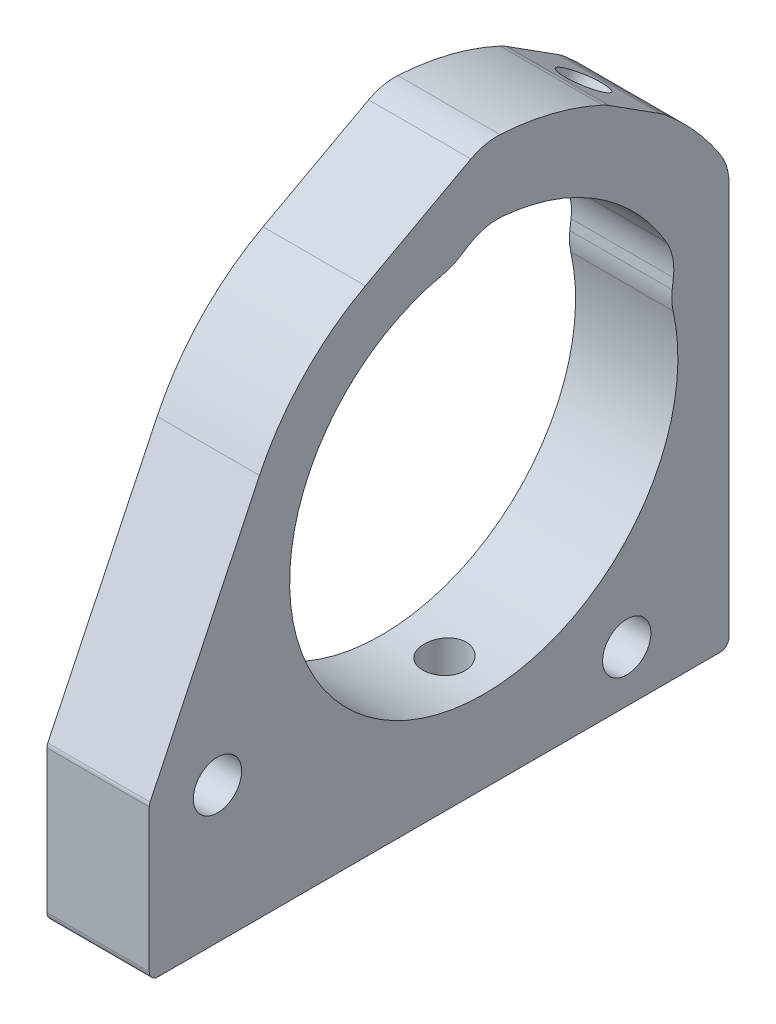
from build123d import *

# Parameters (mm, degrees)
SKETCH1_R               = 2.2479
BOSS_EXTRUDE1_DEPTH     = 4.7625
SKETCH2_R               = 2.0193
CUT_EXTRUDE1_DEPTH      = 9.525
FILLET1_R               = 0.8255
FILLET2_R               = 5.08
FILLET3_R               = 5.08
CUT_EXTRUDE2_REACH      = 67.899
CUT_EXTRUDE2_END_RADIUS = 19.6596
SKETCH4_R               = 2.0193


with BuildPart() as part:
    # Sketch1 → Boss-Extrude1 (new, symmetric)
    with BuildSketch(Plane(origin=(0, 0, 0), x_dir=(0, 0, -1), z_dir=(1, 0, 0))):
        with BuildLine():
            Line((-31.1404, -25.6921), (22.8346, -25.6921))
            Line((22.8346, -25.6921), (22.8346, 3.821096341))
            Line((22.8346, 3.821096341), (22.8346, 13.103329243))
            ThreePointArc((22.8346, 13.103329243), (20.105248524, 16.996916667), (16.720065807, 20.336066331))
            Line((16.720065807, 20.336066331), (11.364530126, 23.747918844))
            ThreePointArc((11.364530126, 23.747918844), (5.82676412, 25.674209127), (0, 26.3271))
            Line((0, 26.3271), (-11.022257836, 20.35999918))
            ThreePointArc((-11.022257836, 20.35999918), (-16.769041287, 15.963050734), (-20.8778164, 10.006823511))
            Line((-20.8778164, 10.006823511), (-31.1404, -11.4046))
            Line((-31.1404, -11.4046), (-31.1404, -25.6921))
        make_face()
        with Locations(Location((13.3096, -20.9169, 0), (0, 0, 180))):
            Circle(SKETCH1_R, mode=Mode.SUBTRACT)
        with Locations(Location((-24.7904, -12.9921, 0), (0, 0, 180))):
            Circle(SKETCH1_R, mode=Mode.SUBTRACT)
        with BuildLine():
            Line((0, 19.6596), (0, 18.0721))
            ThreePointArc((0, 18.0721), (-9.710132252, -15.241854548), (16.378884958, 7.637599488))
            Line((16.378884958, 7.637599488), (17.81764857, 8.308505979))
            ThreePointArc((17.81764857, 8.308505979), (10.56309538, 16.580738468), (0, 19.6596))
        make_face(mode=Mode.SUBTRACT)
    extrude(amount=BOSS_EXTRUDE1_DEPTH, both=True)

    # Sketch2 → Cut-Extrude1 (cut)
    with BuildSketch(Plane.XZ.offset(25.6921)):
        with Locations(Location((0, -1.09474, 0), (0, 0, 270))):
            Circle(SKETCH2_R)
        with Locations(Location((0, 24.30526, 0), (0, 0, 270))):
            Circle(SKETCH2_R)
    extrude(amount=-CUT_EXTRUDE1_DEPTH, mode=Mode.SUBTRACT)

    # Fillet1
    fillet1_edges = [part.edges().sort_by_distance(p)[0] for p in [
        (0, -25.6921, -22.8346),
        (0, -25.6921, 31.1404),
        (0, -11.4046, 31.1404),
    ]]
    fillet(fillet1_edges, radius=FILLET1_R)

    # Chamfer1
    # the kernel refuses this chamfer: 3.302, 1.906410589 mm, written as the material it takes off along each edge
    with BuildSketch(Plane(origin=(-12.550145682, 7.637599488, -16.378884958), x_dir=(0, -0.9448116509539838, -0.32761401713236815), z_dir=(1, 0, 0))) as chamfer1_piece_1_section:
        with BuildLine():
            Line((3.115058273, 0), (-0.285434968, 1.681623622))
            Line((-0.285434968, 1.681623622), (-0.351127983, 1.674862743))
            ThreePointArc((-0.351127983, 1.674862743), (-0.152815077, 0.839772605), (-0.065693014, -0.00676088))
            Line((-0.065693014, -0.00676088), (0.00676088, -0.065693014))
            ThreePointArc((0.00676088, -0.065693014), (1.557097323, 0.026529257), (3.110868588, -0.065906966))
            Line((3.110868588, -0.065906966), (3.115058273, 0))
        make_face()
    chamfer1_piece_1 = extrude(amount=25.100291364, mode=Mode.PRIVATE)
    chamfer1_piece_1 = chamfer1_piece_1 & Plane(origin=(0, 0, 0), x_dir=(0, 0.4226182617407049, -0.9063077870366475), z_dir=(1, 0, 0)) * Cylinder(19.6596, 63, mode=Mode.PRIVATE)
    add(chamfer1_piece_1, mode=Mode.SUBTRACT)
    with BuildSketch(Plane(origin=(12.550145682, 18.0721, 0), x_dir=(0, -0.10237552272911479, 0.9947458229849173), z_dir=(-1, 0, 0))) as chamfer1_piece_2_section:
        with BuildLine():
            Line((3.115058273, 0), (-0.285434968, 1.681623622))
            Line((-0.285434968, 1.681623622), (-0.351127983, 1.674862743))
            ThreePointArc((-0.351127983, 1.674862743), (-0.152815077, 0.839772605), (-0.065693014, -0.00676088))
            Line((-0.065693014, -0.00676088), (0.00676088, -0.065693014))
            ThreePointArc((0.00676088, -0.065693014), (1.557097323, 0.026529257), (3.110868588, -0.065906966))
            Line((3.110868588, -0.065906966), (3.115058273, 0))
        make_face()
    chamfer1_piece_2 = extrude(amount=25.100291364, mode=Mode.PRIVATE)
    chamfer1_piece_2 = chamfer1_piece_2 & Plane(origin=(0, 0, 0), x_dir=(0, 0.4226182617407049, -0.9063077870366475), z_dir=(1, 0, 0)) * Cylinder(19.6596, 63, mode=Mode.PRIVATE)
    add(chamfer1_piece_2, mode=Mode.SUBTRACT)

    # Fillet2
    fillet2_edges = [part.edges().sort_by_distance(p)[0] for p in [
        (0, 26.3271, 0),
        (0, 23.747918844, -11.364530126),
        (0, 20.336066331, -16.720065807),
        (0, 13.103329243, -22.8346),
    ]]
    fillet(fillet2_edges, radius=FILLET2_R)

    # Fillet3
    fillet3_edges = [part.edges().sort_by_distance(p)[0] for p in [
        (0, 17.823556008, 2.98691306),
        (0, 4.825497693, -17.415951608),
        (0, 8.2447084, -17.847259049),
        (0, 19.659474186, 0.070334171),
    ]]
    fillet(fillet3_edges, radius=FILLET3_R)

    # Cut-Extrude2: up to this cylinder (the profile starts outside it)
    cut_extrude2_end = Plane(origin=(0, 0, 0), z_dir=(-1, 0, 0)) * Cylinder(CUT_EXTRUDE2_END_RADIUS, 176.1172, mode=Mode.PRIVATE)
    # Sketch4 → Cut-Extrude2 (cut, up to the surface)
    with BuildSketch(Plane(origin=(0, 22.041992588, -14.042297966), x_dir=(1, 0, 0), z_dir=(0, 0.8433914458128872, -0.5372996083468217)), mode=Mode.PRIVATE) as cut_extrude2_sk1:
        with Locations(Location((0, 0, 0), (0, 0, 270))):
            Circle(SKETCH4_R)
    cut_extrude2_tool1 = extrude(cut_extrude2_sk1.sketch, amount=-CUT_EXTRUDE2_REACH, mode=Mode.PRIVATE) - cut_extrude2_end
    add(cut_extrude2_tool1.solids().sort_by_distance((0, 22.041993, -14.042298))[0], mode=Mode.SUBTRACT)


solid = part.part
